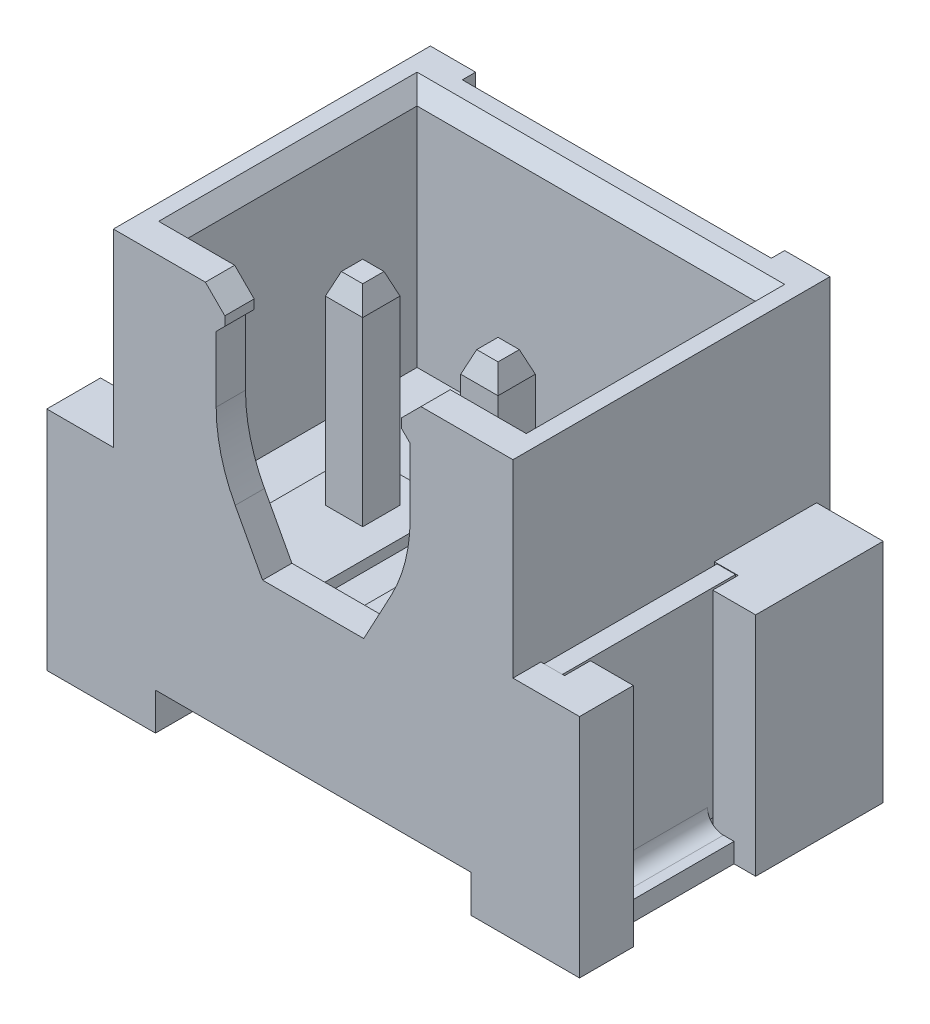
from build123d import *
from OCP.BRepFilletAPI import BRepFilletAPI_MakeChamfer

# Parameters (mm, degrees)
SKETCH1_W           = 10
SKETCH1_H           = 5.7
BOSS_EXTRUDE1_DEPTH = 4.25
BOSS_EXTRUDE2_DEPTH = 3.55
BOSS_EXTRUDE3_DEPTH = 0.25
SKETCH4_W           = 6.399999999999999
SKETCH4_H           = 4.6
CUT_EXTRUDE1_DEPTH  = 4.55
BOSS_EXTRUDE4_DEPTH = 0.2
BOSS_EXTRUDE5_DEPTH = 4
CHAMFER1_SIZE       = 0.25
CHAMFER1_SIZE2      = 0.3
CUT_EXTRUDE5_DEPTH  = 0.55
CUT_EXTRUDE6_DEPTH  = 12.011017210049216
CHAMFER2_SIZE       = 0.4
CHAMFER2_SIZE2      = 0.15
BOSS_EXTRUDE6_DEPTH = 6.45
CHAMFER3_SIZE       = 0.15
CHAMFER3_SIZE2      = 0.4
CUT_EXTRUDE7_DEPTH  = 2
FILLET1_R           = 1
CUT_EXTRUDE8_DEPTH  = 11.749015904295446
SKETCH13_W          = 0.34470786446686574
SKETCH13_H          = 3.258573050104898
SKETCH13_H_2        = 3.2585730501048964
BOSS_EXTRUDE7_DEPTH = 4.2
SKETCH14_W          = 2.1962459212727503
SKETCH14_H          = 0.3660162451661128
BOSS_EXTRUDE8_DEPTH = 0.5
SKETCH15_W          = 0.34470786446686574
SKETCH15_H          = 0.535927560103362
SKETCH15_H_2        = 0.526399568728786
SKETCH15_H_3        = 0.5263995687287861
CUT_EXTRUDE9_DEPTH  = 0.5
SKETCH16_W          = 0.34470786446686574
SKETCH16_H          = 3.2585730501048964
SKETCH16_H_2        = 3.258573050104898
CUT_EXTRUDE10_DEPTH = 0.01
FILLET3_R           = 0.3
FILLET4_R           = 0.6


with BuildPart() as part:
    # Sketch1 → Boss-Extrude1 (new body)
    with BuildSketch(Plane(origin=(0, 0, 0), x_dir=(1, 0, 0), z_dir=(0, 1, 0))):
        Rectangle(SKETCH1_W, SKETCH1_H)
    extrude(amount=BOSS_EXTRUDE1_DEPTH)

    # Sketch2 → Boss-Extrude2 (add)
    with BuildSketch(Plane(origin=(0, 4.25, 0), x_dir=(1, 0, 0), z_dir=(0, 1, 0))):
        Polygon((-3.75, 2.8499999999999996), (3.75, 2.8499999999999996), (3.7499999999999996, -2.8500000000000005), (-3.7499999999999987, -2.8500000000000005), align=None)
    extrude(amount=BOSS_EXTRUDE2_DEPTH)

    # Sketch3 → Boss-Extrude3 (add)
    with BuildSketch(Plane(origin=(0, 0, -2.8499999999999996), x_dir=(-1, 0, 0), z_dir=(0, 0, -1))):
        Polygon((-3.75, 7.8), (-2.9, 7.8), (-2.899999999999999, 8e-17), (-3.75, 0), align=None)
        Polygon((3.75, 0), (2.899999999999999, 8e-17), (2.9, 7.8), (3.75, 7.8), align=None)
    extrude(amount=BOSS_EXTRUDE3_DEPTH)

    # Sketch4 → Cut-Extrude1 (cut)
    with BuildSketch(Plane(origin=(0, 7.8, 0), x_dir=(1, 0, 0), z_dir=(0, 1, 0))):
        Rectangle(SKETCH4_W, SKETCH4_H)
    extrude(amount=-CUT_EXTRUDE1_DEPTH, mode=Mode.SUBTRACT)

    # Sketch5 → Boss-Extrude4 (add)
    # profile 1 of 2: a face of its own
    with BuildSketch(Plane(origin=(0, 3.2499999999999996, 0), x_dir=(1, 0, 0), z_dir=(0, 1, 0))):
        Polygon((-2.174999999999999, -2.3000000000000003), (-2.174999999999999, 0.19999999999999923), (-0.3749999999999999, 0.1999999999999991), (-0.37499999999999944, -2.3000000000000003), align=None)
        Polygon((-1.6199999999999999, -0.30010615600666696), (-0.9199999999999999, -0.30010615600666696), (-0.9199999999999997, -1.0001061560066669), (-1.6199999999999997, -1.0001061560066669), align=None, mode=Mode.SUBTRACT)
    # profile 2 of 2: a face of its own
    with BuildSketch(Plane(origin=(0, 3.2499999999999996, 0), x_dir=(1, 0, 0), z_dir=(0, 1, 0))):
        Polygon((2.174999999999999, -2.3000000000000003), (0.37499999999999944, -2.3000000000000003), (0.3749999999999999, 0.1999999999999991), (2.174999999999999, 0.19999999999999923), align=None)
        Polygon((1.6199999999999997, -1.0001061560066669), (0.9199999999999997, -1.0001061560066669), (0.9199999999999999, -0.30010615600666696), (1.6199999999999999, -0.30010615600666696), align=None, mode=Mode.SUBTRACT)
    extrude(amount=BOSS_EXTRUDE4_DEPTH)

    # Sketch6 → Boss-Extrude5 (add)
    with BuildSketch(Plane(origin=(0, 3.2499999999999996, 0), x_dir=(1, 0, 0), z_dir=(0, 1, 0))):
        Polygon((-0.9199999999999997, -1.0001061560066669), (-0.9199999999999999, -0.30010615600666696), (-1.6199999999999999, -0.30010615600666696), (-1.6199999999999997, -1.0001061560066669), align=None)
        Polygon((1.6199999999999997, -1.0001061560066669), (1.6199999999999999, -0.30010615600666696), (0.9199999999999999, -0.30010615600666696), (0.9199999999999997, -1.0001061560066669), align=None)
    extrude(amount=BOSS_EXTRUDE5_DEPTH)

    # Chamfer1
    chamfer1_edges = [part.edges().sort_by_distance(p)[0] for p in [
        (3.1999999999999993, 7.8, 4.4e-16),
        (4.4e-16, 7.8, -2.2999999999999994),
        (-3.199999999999999, 7.8, 4.4e-16),
    ]]
    chamfer1_side = [part.faces().sort_by_distance(p)[0] for p in [
        (-2.99573531218939, 7.8, -2.9749999999999996),
    ]]
    chamfer(chamfer1_edges, length=CHAMFER1_SIZE, length2=CHAMFER1_SIZE2, reference=chamfer1_side[0])

    # Sketch7 → Cut-Extrude5 (cut)
    with BuildSketch(Plane.XY.offset(2.8500000000000005)):
        with BuildLine():
            Line((-2.0230768172750717, 7.8), (-1.658152916079166, 7.435076098804102))
            Line((-1.658152916079166, 7.435076098804102), (-1.658152916079166, 7.263136663157135))
            Line((-1.658152916079166, 7.263136663157135), (-1.8201957124672143, 7.101093866769083))
            Line((-1.8201957124672143, 7.101093866769083), (-1.820195712467214, 5.869596920770719))
            ThreePointArc((-1.820195712467214, 5.869596920770719), (-1.729701032325909, 5.138311207992215), (-1.4636765166579089, 4.4511438063269075))
            Line((-1.4636765166579089, 4.4511438063269075), (-0.9492914576822651, 3.492517105508663))
            Line((-0.9492914576822651, 3.492517105508663), (0.9492914576822654, 3.492517105508663))
            Line((0.9492914576822654, 3.492517105508663), (1.4636765166579093, 4.4511438063269075))
            ThreePointArc((1.4636765166579093, 4.4511438063269075), (1.7297010323259099, 5.1383112079922135), (1.8201957124672148, 5.869596920770719))
            Line((1.8201957124672148, 5.869596920770719), (1.8201957124672143, 7.101093866769083))
            Line((1.8201957124672143, 7.101093866769083), (1.6581529160791668, 7.263136663157135))
            Line((1.6581529160791668, 7.263136663157135), (1.6581529160791668, 7.435076098804102))
            Line((1.6581529160791668, 7.435076098804102), (2.0230768172750717, 7.8))
            Line((2.0230768172750717, 7.8), (-2.0230768172750717, 7.8))
        make_face()
    extrude(amount=-CUT_EXTRUDE5_DEPTH, mode=Mode.SUBTRACT)

    # Sketch8 → Cut-Extrude6 (cut, through all)
    with BuildSketch(Plane.XY.offset(2.8500000000000005)):
        Polygon((-2.96, 0), (2.96, 0), (2.96, 0.7000000000000003), (-2.96, 0.7), align=None)
    extrude(amount=-CUT_EXTRUDE6_DEPTH, mode=Mode.SUBTRACT)

    # Chamfer2: one chamfer whose edges measure the first distance from different faces: ONE call of the kernel's chamfer builder (chamfer() names one face for all edges)
    chamfer2_edges_1 = [part.edges().sort_by_distance(p)[0] for p in [
        (-1.2699999999999996, 7.25, 1.0001061560066669),
    ]]
    chamfer2_side_1 = [part.faces().sort_by_distance(p)[0] for p in [
        (-1.2699999999999998, 5.35, 1.0001061560066669),
    ]]
    chamfer2_edges_2 = [part.edges().sort_by_distance(p)[0] for p in [
        (-0.9199999999999998, 7.25, 0.6501061560066669),
    ]]
    chamfer2_side_2 = [part.faces().sort_by_distance(p)[0] for p in [
        (-0.9199999999999998, 5.35, 0.6501061560066669),
    ]]
    chamfer2_edges_3 = [part.edges().sort_by_distance(p)[0] for p in [
        (-1.27, 7.25, 0.30010615600666696),
    ]]
    chamfer2_side_3 = [part.faces().sort_by_distance(p)[0] for p in [
        (-1.2699999999999998, 5.35, 0.30010615600666696),
    ]]
    chamfer2_edges_4 = [part.edges().sort_by_distance(p)[0] for p in [
        (-1.6199999999999997, 7.25, 0.650106156006667),
    ]]
    chamfer2_side_4 = [part.faces().sort_by_distance(p)[0] for p in [
        (-1.6199999999999997, 5.35, 0.650106156006667),
    ]]
    chamfer2_edges_5 = [part.edges().sort_by_distance(p)[0] for p in [
        (1.2699999999999996, 7.25, 1.0001061560066669),
    ]]
    chamfer2_side_5 = [part.faces().sort_by_distance(p)[0] for p in [
        (1.2699999999999998, 5.35, 1.0001061560066669),
    ]]
    chamfer2_edges_6 = [part.edges().sort_by_distance(p)[0] for p in [
        (1.6199999999999997, 7.25, 0.6501061560066669),
    ]]
    chamfer2_side_6 = [part.faces().sort_by_distance(p)[0] for p in [
        (1.6199999999999997, 5.35, 0.6501061560066669),
    ]]
    chamfer2_edges_7 = [part.edges().sort_by_distance(p)[0] for p in [
        (1.27, 7.25, 0.30010615600666696),
    ]]
    chamfer2_side_7 = [part.faces().sort_by_distance(p)[0] for p in [
        (1.2699999999999998, 5.35, 0.30010615600666696),
    ]]
    chamfer2_edges_8 = [part.edges().sort_by_distance(p)[0] for p in [
        (0.9199999999999998, 7.25, 0.650106156006667),
    ]]
    chamfer2_side_8 = [part.faces().sort_by_distance(p)[0] for p in [
        (0.9199999999999998, 5.35, 0.650106156006667),
    ]]
    chamfer2 = BRepFilletAPI_MakeChamfer(part.part.solid().wrapped)
    for e in chamfer2_edges_1:
        chamfer2.Add(CHAMFER2_SIZE, CHAMFER2_SIZE2, e.wrapped, chamfer2_side_1[0].wrapped)  # the first distance lies on this face
    for e in chamfer2_edges_2:
        chamfer2.Add(CHAMFER2_SIZE, CHAMFER2_SIZE2, e.wrapped, chamfer2_side_2[0].wrapped)  # the first distance lies on this face
    for e in chamfer2_edges_3:
        chamfer2.Add(CHAMFER2_SIZE, CHAMFER2_SIZE2, e.wrapped, chamfer2_side_3[0].wrapped)  # the first distance lies on this face
    for e in chamfer2_edges_4:
        chamfer2.Add(CHAMFER2_SIZE, CHAMFER2_SIZE2, e.wrapped, chamfer2_side_4[0].wrapped)  # the first distance lies on this face
    for e in chamfer2_edges_5:
        chamfer2.Add(CHAMFER2_SIZE, CHAMFER2_SIZE2, e.wrapped, chamfer2_side_5[0].wrapped)  # the first distance lies on this face
    for e in chamfer2_edges_6:
        chamfer2.Add(CHAMFER2_SIZE, CHAMFER2_SIZE2, e.wrapped, chamfer2_side_6[0].wrapped)  # the first distance lies on this face
    for e in chamfer2_edges_7:
        chamfer2.Add(CHAMFER2_SIZE, CHAMFER2_SIZE2, e.wrapped, chamfer2_side_7[0].wrapped)  # the first distance lies on this face
    for e in chamfer2_edges_8:
        chamfer2.Add(CHAMFER2_SIZE, CHAMFER2_SIZE2, e.wrapped, chamfer2_side_8[0].wrapped)  # the first distance lies on this face
    add(Compound.cast(chamfer2.Shape()), mode=Mode.REPLACE)

    # Sketch10 → Boss-Extrude6 (add)
    with BuildSketch(Plane.XY.offset(1.0001061560066669)):
        Polygon((-1.6199999999999999, 0.7000000000000003), (-0.9199999999999997, 0.7000000000000003), (-0.9199999999999996, 0), (-1.6199999999999994, 0), align=None)
        Polygon((1.6199999999999994, 0), (0.9199999999999996, 0), (0.9199999999999997, 0.7000000000000003), (1.6199999999999999, 0.7000000000000003), align=None)
    extrude(amount=-BOSS_EXTRUDE6_DEPTH)

    # Chamfer3: one chamfer whose edges measure the first distance from different faces: ONE call of the kernel's chamfer builder (chamfer() names one face for all edges)
    chamfer3_edges_1 = [part.edges().sort_by_distance(p)[0] for p in [
        (-1.2699999999999998, 0.7000000000000003, -5.449893843993333),
        (-1.6199999999999997, 0.35000000000000014, -5.449893843993333),
        (-0.9199999999999997, 0.35000000000000014, -5.449893843993333),
        (-1.2699999999999996, 0, -5.449893843993333),
    ]]
    chamfer3_side_1 = [part.faces().sort_by_distance(p)[0] for p in [
        (-1.2699999999999996, 0.3500000000000002, -5.449893843993333),
    ]]
    chamfer3_edges_2 = [part.edges().sort_by_distance(p)[0] for p in [
        (1.2699999999999998, 0.7000000000000003, -5.449893843993333),
        (1.6199999999999997, 0.35000000000000014, -5.449893843993333),
        (1.2699999999999996, 0, -5.449893843993333),
        (0.9199999999999997, 0.35000000000000014, -5.449893843993333),
    ]]
    chamfer3_side_2 = [part.faces().sort_by_distance(p)[0] for p in [
        (1.2699999999999996, 0.3500000000000002, -5.449893843993333),
    ]]
    chamfer3 = BRepFilletAPI_MakeChamfer(part.part.solid().wrapped)
    for e in chamfer3_edges_1:
        chamfer3.Add(CHAMFER3_SIZE, CHAMFER3_SIZE2, e.wrapped, chamfer3_side_1[0].wrapped)  # the first distance lies on this face
    for e in chamfer3_edges_2:
        chamfer3.Add(CHAMFER3_SIZE, CHAMFER3_SIZE2, e.wrapped, chamfer3_side_2[0].wrapped)  # the first distance lies on this face
    add(Compound.cast(chamfer3.Shape()), mode=Mode.REPLACE)

    # Sketch11 → Cut-Extrude7 (cut)
    with BuildSketch(Plane(origin=(0, 0, -2.8499999999999996), x_dir=(-1, 0, 0), z_dir=(0, 0, -1))):
        Polygon((-1.8200000000000005, 0.9000000000000004), (-0.7200000000000002, 0.9000000000000004), (-0.7200000000000002, 0.7000000000000004), (-1.82, 0.7000000000000004), align=None)
        Polygon((1.8199999999999994, 0.9000000000000004), (0.7199999999999993, 0.9000000000000004), (0.7199999999999993, 0.7000000000000004), (1.8199999999999992, 0.7000000000000004), align=None)
    extrude(amount=-CUT_EXTRUDE7_DEPTH, mode=Mode.SUBTRACT)

    # Fillet1
    # the kernel refuses this fillet: 1 mm, written as the material it takes off along each edge
    with BuildSketch(Plane(origin=(1.464848003542365, 0, 1.0001061560066669), x_dir=(0, 0, -1), z_dir=(-1, 0, 0))) as fillet1_piece_1:
        with BuildLine():
            CenterArc((0.9539392014169458, -1), FILLET1_R, 90, 72.54239687627793)
            Line((0, -0.7000000000000003), (0, 0))
            Line((0, 0), (0.9539392014169458, 0))
        make_face()
    extrude(amount=3.0848480035423647, mode=Mode.SUBTRACT)
    with BuildSketch(Plane(origin=(1.6199999999999994, 0, 1.0001061560066669), x_dir=(0, 0, -1), z_dir=(-1, 0, 0))) as fillet1_piece_2:
        with BuildLine():
            CenterArc((0.9539392014169458, -1), FILLET1_R, 90, 72.54239687627793)
            Line((0, -0.7000000000000003), (0, 0))
            Line((0, 0), (0.9539392014169458, 0))
        make_face()
    extrude(amount=3.0848480035423638, mode=Mode.SUBTRACT)

    # Sketch12 → Cut-Extrude8 (cut, through all)
    with BuildSketch(Plane(origin=(0, 7.8, 0), x_dir=(1, 0, 0), z_dir=(0, 1, 0))):
        Polygon((5, 0.4556412762642724), (4.194707864466865, 0.4556412762642724), (4.194707864466865, 0.9320408449930586), (3.75, 0.9320408449930585), (3.750000000000001, -2.32653220511184), (4.194707864466865, -2.32653220511184), (4.194707864466865, -1.8406046450084779), (5, -1.8406046450084779), align=None)
        Polygon((-4.194707864466865, -1.8406046450084779), (-5, -1.8406046450084779), (-5, 0.4556412762642724), (-4.194707864466865, 0.4556412762642724), (-4.194707864466865, 0.9320408449930586), (-3.75, 0.9320408449930585), (-3.750000000000001, -2.32653220511184), (-4.194707864466865, -2.32653220511184), align=None)
    extrude(amount=-CUT_EXTRUDE8_DEPTH, mode=Mode.SUBTRACT)

    # Sketch13 → Boss-Extrude7 (add)
    with BuildSketch(Plane(origin=(0, 4.25, 0), x_dir=(1, 0, 0), z_dir=(0, 1, 0))):
        with Locations((3.9723539322334327, -0.6972456800593906)):
            Rectangle(SKETCH13_W, SKETCH13_H)
        with Locations((-3.9723539322334327, -0.6972456800593899)):
            Rectangle(SKETCH13_W, SKETCH13_H_2)
    extrude(amount=-BOSS_EXTRUDE7_DEPTH)

    # Sketch14 → Boss-Extrude8 (add)
    with BuildSketch(Plane(origin=(4.144707864466866, 0, 0), x_dir=(0, 0, -1), z_dir=(1, 0, 0))):
        with Locations((-0.6924816843721028, 0.23300812258305612)):
            Rectangle(SKETCH14_W, SKETCH14_H)
    boss_extrude8 = extrude(amount=BOSS_EXTRUDE8_DEPTH)

    # Mirror3: Boss-Extrude8 across plane
    add(boss_extrude8.mirror(Plane(origin=(0, 0, 0), x_dir=(0, 0, 1), z_dir=(1, 0, 0))))

    # Sketch15 → Cut-Extrude9 (cut)
    with BuildSketch(Plane.XZ):
        with Locations((-3.9723539322334327, 2.058568425060159)):
            Rectangle(SKETCH15_W, SKETCH15_H)
        with Locations((-3.9723539322334327, -0.6688410606286654)):
            Rectangle(SKETCH15_W, SKETCH15_H_2)
        with Locations((3.9723539322334327, 2.058568425060159)):
            Rectangle(SKETCH15_W, SKETCH15_H)
        with Locations((3.9723539322334327, -0.6688410606286654)):
            Rectangle(SKETCH15_W, SKETCH15_H_3)
    extrude(amount=-CUT_EXTRUDE9_DEPTH, mode=Mode.SUBTRACT)

    # Sketch16 → Cut-Extrude10 (cut)
    with BuildSketch(Plane(origin=(0, 4.25, 0), x_dir=(1, 0, 0), z_dir=(0, 1, 0))):
        with Locations((-3.9723539322334327, -0.6972456800593899)):
            Rectangle(SKETCH16_W, SKETCH16_H)
        with Locations((3.9723539322334327, -0.6972456800593906)):
            Rectangle(SKETCH16_W, SKETCH16_H_2)
    extrude(amount=-CUT_EXTRUDE10_DEPTH, mode=Mode.SUBTRACT)

    # Fillet3
    # the kernel refuses this fillet: 0.3 mm, written as the material it adds along each edge
    with BuildSketch(Plane(origin=(4.144707864466866, 0.4160162451661125, -0.4056412762642723), x_dir=(0, 1, 0), z_dir=(0, 0, 1))) as fillet3_piece_1:
        with BuildLine():
            CenterArc((FILLET3_R, -FILLET3_R), FILLET3_R, 90, 90)
            Line((0, -FILLET3_R), (0, 0))
            Line((0, 0), (FILLET3_R, 0))
        make_face()
    extrude(amount=2.1962459212727503)
    with BuildSketch(Plane(origin=(-4.144707864466866, 0.4160162451661125, -0.4056412762642723), x_dir=(-1, 0, 0), z_dir=(0, 0, 1))) as fillet3_piece_2:
        with BuildLine():
            CenterArc((FILLET3_R, -FILLET3_R), FILLET3_R, 90, 90)
            Line((0, -FILLET3_R), (0, 0))
            Line((0, 0), (FILLET3_R, 0))
        make_face()
    extrude(amount=2.1962459212727503)

    # Fillet4
    fillet4_edges = [part.edges().sort_by_distance(p)[0] for p in [
        (3.7999999999999994, 0.04999999999999982, 0.6924816843721027),
        (-3.7999999999999994, 0.04999999999999982, 0.6924816843721029),
    ]]
    fillet(fillet4_edges, radius=FILLET4_R)


solid = part.part
